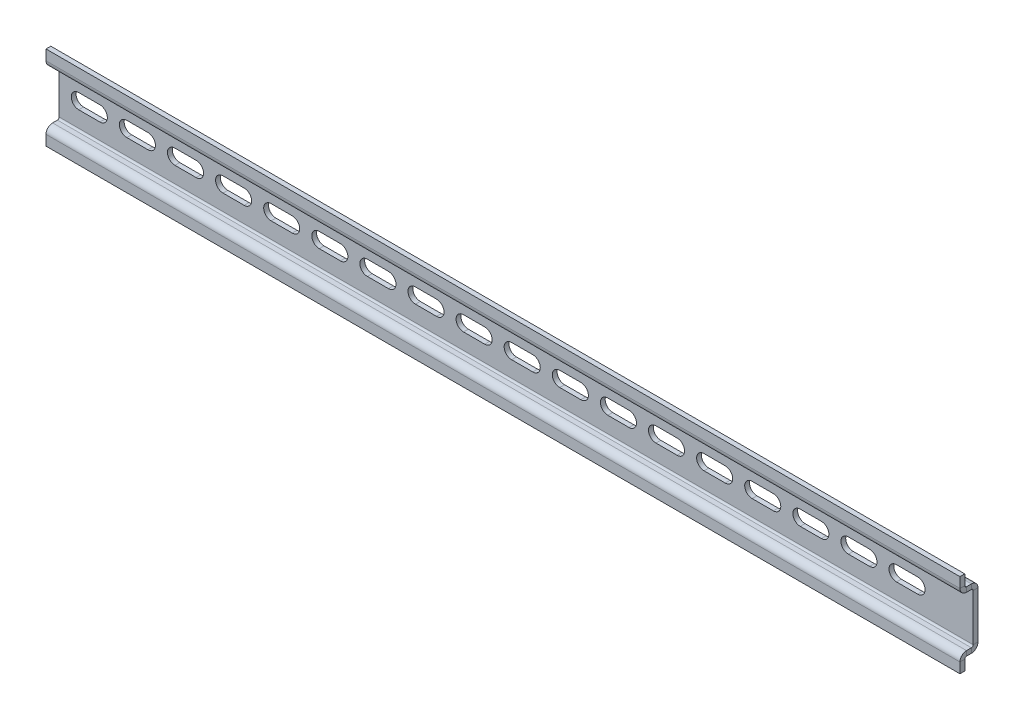
from build123d import *

# Parameters (mm, degrees)
TABAN_FLAN_4_DEPTH     = 380
KES_EKSTR_ZYON11_DEPTH = 10


# Sheet-metal steps are written as plain solids
with BuildPart() as part:
    # Çizim18 → Taban-Flanş4 (new body)
    with BuildSketch(Plane(origin=(0, 0, 0), x_dir=(0, 0, -1), z_dir=(1, 0, 0))):
        with BuildLine():
            Line((-5.5, 17.5), (-5.5, 13.2366))
            ThreePointArc((-5.5, 13.2366), (-5.284254855, 12.715745145), (-4.7634, 12.5))
            Line((-4.7634, 12.5), (-2.7366, 12.5))
            ThreePointArc((-2.7366, 12.5), (-0.801531583, 11.698468417), (0, 9.7634))
            Line((0, 9.7634), (0, -9.7634))
            ThreePointArc((0, -9.7634), (-0.801531583, -11.698468417), (-2.7366, -12.5))
            Line((-2.7366, -12.5), (-4.7634, -12.5))
            ThreePointArc((-4.7634, -12.5), (-5.284254855, -12.715745145), (-5.5, -13.2366))
            Line((-5.5, -13.2366), (-5.5, -17.5))
            Line((-5.5, -17.5), (-7.5, -17.5))
            Line((-7.5, -17.5), (-7.5, -13.2366))
            ThreePointArc((-7.5, -13.2366), (-6.698468417, -11.301531583), (-4.7634, -10.5))
            Line((-4.7634, -10.5), (-2.7366, -10.5))
            ThreePointArc((-2.7366, -10.5), (-2.215745145, -10.284254855), (-2, -9.7634))
            Line((-2, -9.7634), (-2, 9.7634))
            ThreePointArc((-2, 9.7634), (-2.215745145, 10.284254855), (-2.7366, 10.5))
            Line((-2.7366, 10.5), (-4.7634, 10.5))
            ThreePointArc((-4.7634, 10.5), (-6.698468417, 11.301531583), (-7.5, 13.2366))
            Line((-7.5, 13.2366), (-7.5, 17.5))
            Line((-7.5, 17.5), (-5.5, 17.5))
        make_face()
    extrude(amount=TABAN_FLAN_4_DEPTH)

    # Çizim21 → Kes-Ekstrüzyon11 (cut)
    with BuildSketch(Plane.XY.offset(2)):
        with BuildLine():
            Line((8.1, 3.1), (16.9, 3.1))
            ThreePointArc((16.9, 3.1), (20, 0), (16.9, -3.1))
            Line((16.9, -3.1), (8.1, -3.1))
            ThreePointArc((8.1, -3.1), (5, 0), (8.1, 3.1))
        make_face()
        with BuildLine():
            Line((28.1, 3.1), (36.9, 3.1))
            ThreePointArc((36.9, 3.1), (40, 0), (36.9, -3.1))
            Line((36.9, -3.1), (28.1, -3.1))
            ThreePointArc((28.1, -3.1), (25, 0), (28.1, 3.1))
        make_face()
        with BuildLine():
            Line((48.1, 3.1), (56.9, 3.1))
            ThreePointArc((56.9, 3.1), (60, 0), (56.9, -3.1))
            Line((56.9, -3.1), (48.1, -3.1))
            ThreePointArc((48.1, -3.1), (45, 0), (48.1, 3.1))
        make_face()
        with BuildLine():
            Line((68.1, 3.1), (76.9, 3.1))
            ThreePointArc((76.9, 3.1), (80, 0), (76.9, -3.1))
            Line((76.9, -3.1), (68.1, -3.1))
            ThreePointArc((68.1, -3.1), (65, 0), (68.1, 3.1))
        make_face()
        with BuildLine():
            Line((88.1, 3.1), (96.9, 3.1))
            ThreePointArc((96.9, 3.1), (100, 0), (96.9, -3.1))
            Line((96.9, -3.1), (88.1, -3.1))
            ThreePointArc((88.1, -3.1), (85, 0), (88.1, 3.1))
        make_face()
        with BuildLine():
            Line((108.1, 3.1), (116.9, 3.1))
            ThreePointArc((116.9, 3.1), (120, 0), (116.9, -3.1))
            Line((116.9, -3.1), (108.1, -3.1))
            ThreePointArc((108.1, -3.1), (105, 0), (108.1, 3.1))
        make_face()
        with BuildLine():
            Line((128.1, 3.1), (136.9, 3.1))
            ThreePointArc((136.9, 3.1), (140, 0), (136.9, -3.1))
            Line((136.9, -3.1), (128.1, -3.1))
            ThreePointArc((128.1, -3.1), (125, 0), (128.1, 3.1))
        make_face()
        with BuildLine():
            Line((148.1, 3.1), (156.9, 3.1))
            ThreePointArc((156.9, 3.1), (160, 0), (156.9, -3.1))
            Line((156.9, -3.1), (148.1, -3.1))
            ThreePointArc((148.1, -3.1), (145, 0), (148.1, 3.1))
        make_face()
        with BuildLine():
            Line((168.1, 3.1), (176.9, 3.1))
            ThreePointArc((176.9, 3.1), (180, 0), (176.9, -3.1))
            Line((176.9, -3.1), (168.1, -3.1))
            ThreePointArc((168.1, -3.1), (165, 0), (168.1, 3.1))
        make_face()
        with BuildLine():
            Line((188.1, 3.1), (196.9, 3.1))
            ThreePointArc((196.9, 3.1), (200, 0), (196.9, -3.1))
            Line((196.9, -3.1), (188.1, -3.1))
            ThreePointArc((188.1, -3.1), (185, 0), (188.1, 3.1))
        make_face()
        with BuildLine():
            Line((208.1, 3.1), (216.9, 3.1))
            ThreePointArc((216.9, 3.1), (220, 0), (216.9, -3.1))
            Line((216.9, -3.1), (208.1, -3.1))
            ThreePointArc((208.1, -3.1), (205, 0), (208.1, 3.1))
        make_face()
        with BuildLine():
            Line((228.1, 3.1), (236.9, 3.1))
            ThreePointArc((236.9, 3.1), (240, 0), (236.9, -3.1))
            Line((236.9, -3.1), (228.1, -3.1))
            ThreePointArc((228.1, -3.1), (225, 0), (228.1, 3.1))
        make_face()
        with BuildLine():
            Line((248.1, 3.1), (256.9, 3.1))
            ThreePointArc((256.9, 3.1), (260, 0), (256.9, -3.1))
            Line((256.9, -3.1), (248.1, -3.1))
            ThreePointArc((248.1, -3.1), (245, 0), (248.1, 3.1))
        make_face()
        with BuildLine():
            Line((268.1, 3.1), (276.9, 3.1))
            ThreePointArc((276.9, 3.1), (280, 0), (276.9, -3.1))
            Line((276.9, -3.1), (268.1, -3.1))
            ThreePointArc((268.1, -3.1), (265, 0), (268.1, 3.1))
        make_face()
        with BuildLine():
            Line((288.1, 3.1), (296.9, 3.1))
            ThreePointArc((296.9, 3.1), (300, 0), (296.9, -3.1))
            Line((296.9, -3.1), (288.1, -3.1))
            ThreePointArc((288.1, -3.1), (285, 0), (288.1, 3.1))
        make_face()
        with BuildLine():
            Line((308.1, 3.1), (316.9, 3.1))
            ThreePointArc((316.9, 3.1), (320, 0), (316.9, -3.1))
            Line((316.9, -3.1), (308.1, -3.1))
            ThreePointArc((308.1, -3.1), (305, 0), (308.1, 3.1))
        make_face()
        with BuildLine():
            Line((328.1, 3.1), (336.9, 3.1))
            ThreePointArc((336.9, 3.1), (340, 0), (336.9, -3.1))
            Line((336.9, -3.1), (328.1, -3.1))
            ThreePointArc((328.1, -3.1), (325, 0), (328.1, 3.1))
        make_face()
        with BuildLine():
            Line((348.1, 3.1), (356.9, 3.1))
            ThreePointArc((356.9, 3.1), (360, 0), (356.9, -3.1))
            Line((356.9, -3.1), (348.1, -3.1))
            ThreePointArc((348.1, -3.1), (345, 0), (348.1, 3.1))
        make_face()
    extrude(amount=-KES_EKSTR_ZYON11_DEPTH, mode=Mode.SUBTRACT)


solid = part.part
